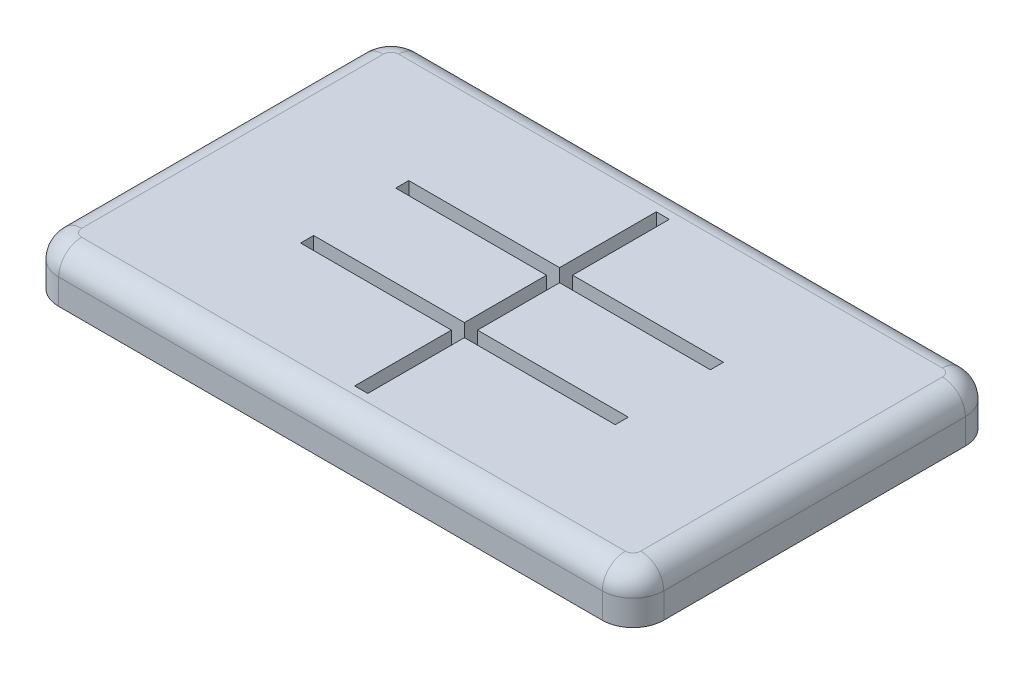
from build123d import *

# Parameters (mm, degrees)
SKETCH1_W           = 250
SKETCH1_H           = 150
BOSS_EXTRUDE1_DEPTH = 20
FILLET1_R           = 12.7
FILLET2_R           = 9.5
CAVITY1_START       = -65
CAVITY1_OUTLINE_W   = 20
CAVITY1_OUTLINE_H   = 5.4
CAVITY1_DEPTH       = 130
CAVITY1_START_2     = -2.7
CAVITY1_2_OUTLINE_W = 20
CAVITY1_2_OUTLINE_H = 33.9
CAVITY1_2_DEPTH     = 5.4


# Read off the part's stored shape, not the designer's step: Cavity1
with BuildPart() as part:
    # Sketch1 → Boss-Extrude1 (new body)
    with BuildSketch(Plane(origin=(0, 0, 0), x_dir=(1, 0, 0), z_dir=(0, 1, 0))):
        Rectangle(SKETCH1_W, SKETCH1_H)
    extrude(amount=-BOSS_EXTRUDE1_DEPTH)

    # Fillet1
    fillet1_edges = [part.edges().sort_by_distance(p)[0] for p in [
        (125, -10, 75),
        (-125, -10, 75),
        (-125, -10, -75),
        (125, -10, -75),
    ]]
    fillet(fillet1_edges, radius=FILLET1_R)

    # Fillet2
    fillet2_edges = [part.edges().sort_by_distance(p)[0] for p in [
        (0, 0, -75),
        (125, 0, 0),
        (-125, 0, 0),
        (0, 0, 75),
        (121.280256121, 0, 71.280256121),
        (-121.280256121, 0, 71.280256121),
        (121.280256121, 0, -71.280256121),
        (-121.280256121, 0, -71.280256121),
    ]]
    fillet(fillet2_edges, radius=FILLET2_R)

    # Cavity1 outline → Cavity1 (cut)
    with BuildSketch(Plane.YZ.offset(CAVITY1_START)):
        with Locations((-10, 19.65)):
            Rectangle(CAVITY1_OUTLINE_W, CAVITY1_OUTLINE_H)
        with Locations((-10, -19.65)):
            Rectangle(CAVITY1_OUTLINE_W, CAVITY1_OUTLINE_H)
    extrude(amount=CAVITY1_DEPTH, mode=Mode.SUBTRACT)

    # Cavity1 2 outline → Cavity1 2 (cut)
    with BuildSketch(Plane.YZ.offset(CAVITY1_START_2)):
        with Locations((-10, 0)):
            Rectangle(CAVITY1_2_OUTLINE_W, CAVITY1_2_OUTLINE_H)
        with BuildLine():
            Line((-20, 22.35), (0, 22.35))
            Line((0, 22.35), (0, 62.3))
            Line((0, 62.3), (-19, 62.3))
            ThreePointArc((-19, 62.3), (-19.707106781, 62.007106781), (-20, 61.3))
            Line((-20, 61.3), (-20, 22.35))
        make_face()
        with BuildLine():
            Line((0, -62.3), (0, -22.35))
            Line((0, -22.35), (-20, -22.35))
            Line((-20, -22.35), (-20, -61.3))
            ThreePointArc((-20, -61.3), (-19.707106781, -62.007106781), (-19, -62.3))
            Line((-19, -62.3), (0, -62.3))
        make_face()
    extrude(amount=CAVITY1_2_DEPTH, mode=Mode.SUBTRACT)


solid = part.part
